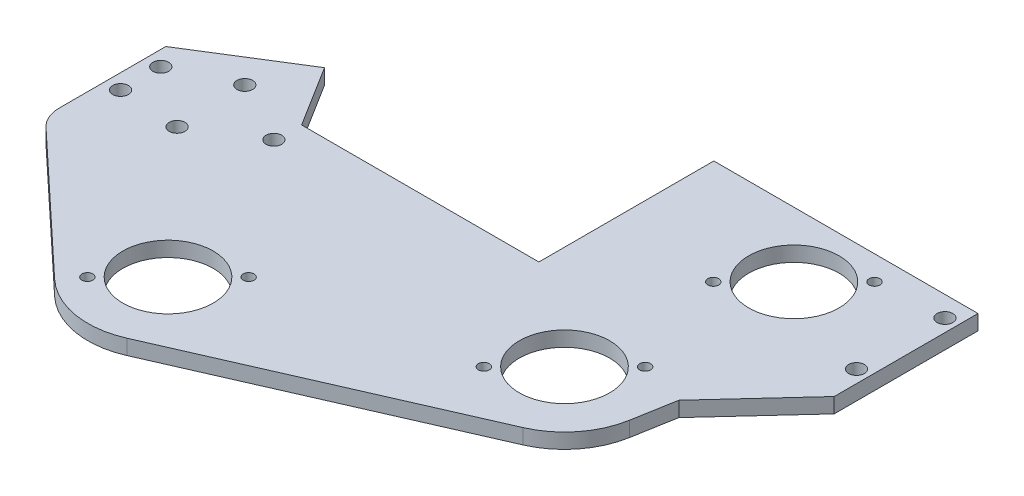
from build123d import *

# Parameters (mm, degrees)
SKETCH1_R                 = 14.29004
BOSS_EXTRUDE1_DEPTH       = 4.7625
FILLET1_R                 = 10
F_10_CLEARANCE_HOLE1_D    = 4.9784
F_10_CLEARANCE_HOLE2_D    = 4.9784
TAP_DRILL_FOR_8_32_TAP1_D = 3.4544


with BuildPart() as part:
    # Sketch1 → Boss-Extrude1 (new body)
    with BuildSketch(Plane(origin=(0, 0, 0), x_dir=(1, 0, 0), z_dir=(0, 1, 0))):
        with BuildLine():
            Line((-62.038222018, -79.883349745), (25.167081601, -41.695780276))
            ThreePointArc((25.167081601, -41.695780276), (34.91524479, -34.148496119), (39.940188099, -22.890693115))
            Line((39.940188099, -22.890693115), (42.275148896, -9.586739751))
            Line((42.275148896, -9.586739751), (65.831008632, 16.012754812))
            Line((65.831008632, 16.012754812), (65.831008632, 61.493591694))
            Line((65.831008632, 61.493591694), (-17.734439664, 61.493591694))
            Line((-17.734439664, 61.493591694), (-17.734439664, 6.164335762))
            Line((-17.734439664, 6.164335762), (-92.776174625, 6.164335762))
            Line((-92.776174625, 6.164335762), (-104.850431309, 25.487185645))
            Line((-104.850431309, 25.487185645), (-135.754362541, 6.176266165))
            Line((-135.754362541, 6.176266165), (-135.754362541, -31.923733805))
            Line((-135.754362541, -31.923733805), (-89.58881583, -75.156212804))
            ThreePointArc((-89.58881583, -75.156212804), (-76.522282462, -81.650581076), (-62.038222018, -79.883349745))
        make_face()
        with Locations((28.046575186, 41.045834415)):
            Circle(SKETCH1_R, mode=Mode.SUBTRACT)
        with Locations((15.031008632, -18.508482198)):
            Circle(SKETCH1_R, mode=Mode.SUBTRACT)
        with Locations((-72.258332946, -56.628468385)):
            Circle(SKETCH1_R, mode=Mode.SUBTRACT)
    extrude(amount=BOSS_EXTRUDE1_DEPTH)

    # Fillet1
    fillet1_edges = [part.edges().sort_by_distance(p)[0] for p in [
        (-135.754362541, 2.38125, 31.923733805),
    ]]
    fillet(fillet1_edges, radius=FILLET1_R)

    # #10 Clearance Hole1 (through all)
    with Locations(Plane(origin=(0, 4.7625, 0), x_dir=(1, 0, 0), z_dir=(0, 1, 0))):
        with Locations((61.830508632, 55.015834415), (61.830508632, 27.075834415), (-130.991862541, -0.185664238), (-130.991862541, -12.885664238)):
            Hole(F_10_CLEARANCE_HOLE1_D / 2)

    # #10 Clearance Hole2 (through all)
    with Locations(Plane(origin=(0, 4.7625, 0), x_dir=(1, 0, 0), z_dir=(0, 1, 0))):
        with Locations((-111.967153366, -14.051247514), (-93.119284429, -2.273791866), (-112.732400526, 8.143579493)):
            Hole(F_10_CLEARANCE_HOLE2_D / 2)

    # Tap Drill for #8-32 Tap1 (through all)
    with Locations(Plane(origin=(0, 4.7625, 0), x_dir=(1, 0, 0), z_dir=(0, 1, 0))):
        with Locations((-59.506369254, -43.876504694), (-85.010296638, -69.380432077), (2.27904494, -31.26044589), (27.782972324, -5.756518506), (15.294611495, 28.293870723), (40.798538878, 53.797798107)):
            Hole(TAP_DRILL_FOR_8_32_TAP1_D / 2)


solid = part.part
